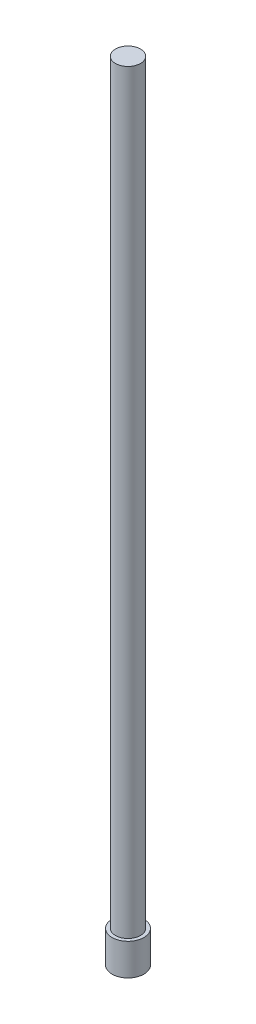
from build123d import *

# Parameters (mm, degrees)
SKETCH1_R           = 2
SKETCH1_R_2         = 1.025
BOSS_EXTRUDE1_DEPTH = 3
SKETCH2_R           = 2
BOSS_EXTRUDE2_DEPTH = 1
SKETCH3_R           = 1.575
BOSS_EXTRUDE3_DEPTH = 95


with BuildPart() as part:
    # Sketch1 → Boss-Extrude1 (new body)
    with BuildSketch(Plane(origin=(0, 0, 0), x_dir=(1, 0, 0), z_dir=(0, 1, 0))):
        Circle(SKETCH1_R)
        Circle(SKETCH1_R_2, mode=Mode.SUBTRACT)
    extrude(amount=BOSS_EXTRUDE1_DEPTH)

    # Sketch2 → Boss-Extrude2 (add)
    with BuildSketch(Plane(origin=(0, 3, 0), x_dir=(1, 0, 0), z_dir=(0, 1, 0))):
        Circle(SKETCH2_R)
    extrude(amount=BOSS_EXTRUDE2_DEPTH)

    # Sketch3 → Boss-Extrude3 (add)
    with BuildSketch(Plane(origin=(0, 4, 0), x_dir=(1, 0, 0), z_dir=(0, 1, 0))):
        Circle(SKETCH3_R)
    extrude(amount=BOSS_EXTRUDE3_DEPTH)


solid = part.part
